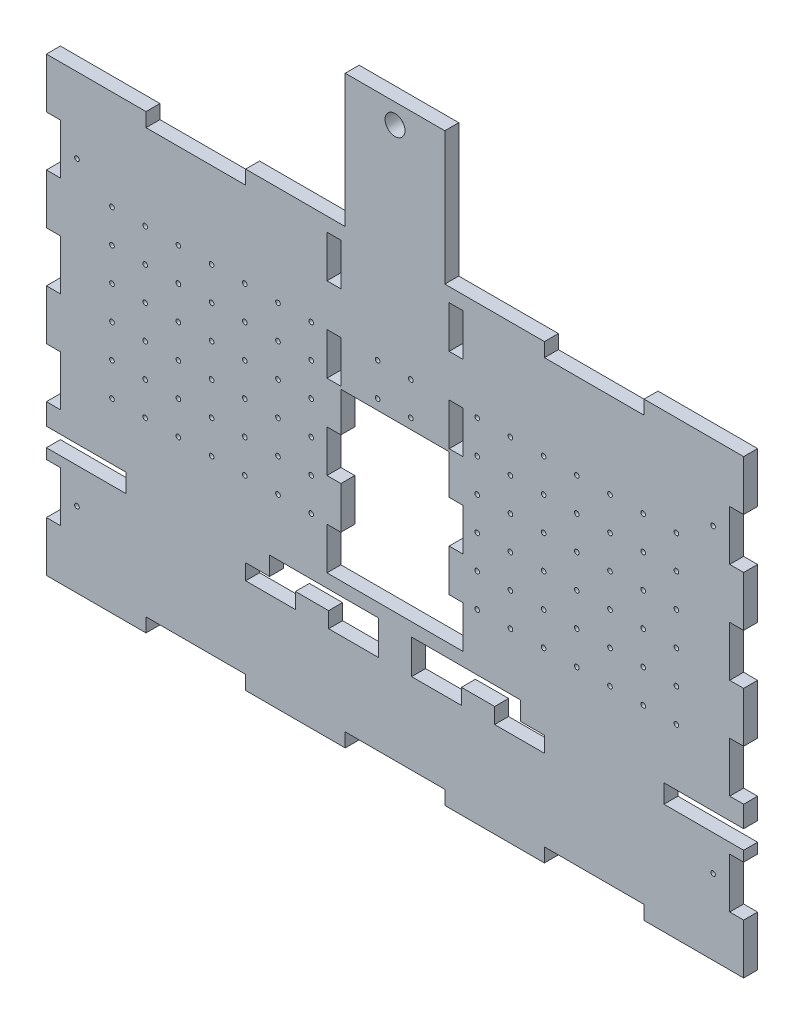
from build123d import *

# Parameters (mm, degrees)
SKETCH1_W           = 266.7
SKETCH1_H           = 172.72
BOSS_EXTRUDE1_DEPTH = 5.334
SKETCH2_W           = 38.1
SKETCH2_H           = 5.334
CUT_EXTRUDE1_DEPTH  = 165.701204222
SKETCH5_W           = 41.656
SKETCH5_H           = 7.112
CUT_EXTRUDE3_DEPTH  = 165.701204222
SKETCH9_W           = 5.334
SKETCH9_H           = 19.191111111
CUT_EXTRUDE7_DEPTH  = 165.701204222
SKETCH10_W          = 38.1
SKETCH10_H          = 5.334
BOSS_EXTRUDE2_DEPTH = 50.8
SKETCH11_W          = 6.604
SKETCH11_H          = 40.64
CUT_EXTRUDE8_DEPTH  = 197.710659379
SKETCH12_R          = 3.81
CUT_EXTRUDE9_DEPTH  = 197.710659379
SKETCH14_R          = 0.889
CUT_EXTRUDE11_DEPTH = 197.710659379
SKETCH15_W          = 6.604
SKETCH15_H          = 10.16
CUT_EXTRUDE12_DEPTH = 197.710659379
SKETCH16_W          = 41.402
SKETCH16_H          = 63.5
CUT_EXTRUDE13_DEPTH = 197.710659379
SKETCH17_W          = 5.334
SKETCH17_H          = 16.124650759
SKETCH17_H_2        = 16.124650758
CUT_EXTRUDE14_DEPTH = 197.710659379
SKETCH18_W          = 38.1
SKETCH18_H          = 56.134
BOSS_EXTRUDE3_DEPTH = 5.334
SKETCH19_W          = 34.756768033
SKETCH19_H          = 54.94363668
CUT_EXTRUDE15_DEPTH = 197.710659379
SKETCH20_R          = 3.81
CUT_EXTRUDE16_DEPTH = 197.710659379
SKETCH21_R          = 0.889
CUT_EXTRUDE17_DEPTH = 197.710659379
SKETCH22_W          = 19.05
SKETCH22_H          = 5.993691658
CUT_EXTRUDE18_DEPTH = 197.710659379


with BuildPart() as part:
    # Sketch1 → Boss-Extrude1 (new body)
    with BuildSketch(Plane.XY):
        with Locations((5.474099752, 2.104142138)):
            Rectangle(SKETCH1_W, SKETCH1_H)
    extrude(amount=BOSS_EXTRUDE1_DEPTH)

    # Sketch2 → Cut-Extrude1 (cut, through all)
    with BuildSketch(Plane.XY.offset(5.334)):
        with Locations((-70.725900248, -81.588857862)):
            Rectangle(SKETCH2_W, SKETCH2_H)
        with Locations((5.474099752, -81.588857862)):
            Rectangle(SKETCH2_W, SKETCH2_H)
        with Locations((81.674099752, -81.588857862)):
            Rectangle(SKETCH2_W, SKETCH2_H)
        with Locations((81.674099752, 85.797142138)):
            Rectangle(SKETCH2_W, SKETCH2_H)
        with Locations((5.474099752, 85.797142138)):
            Rectangle(SKETCH2_W, SKETCH2_H)
        with Locations((-70.725900248, 85.797142138)):
            Rectangle(SKETCH2_W, SKETCH2_H)
    extrude(amount=-CUT_EXTRUDE1_DEPTH, mode=Mode.SUBTRACT)

    # Sketch5 → Cut-Extrude3 (cut, through all)
    with BuildSketch(Plane.XY.offset(5.334)):
        with Locations((32.652099752, -38.378413173)):
            Rectangle(SKETCH5_W, SKETCH5_H)
        with Locations((-21.703900248, -38.378413173)):
            Rectangle(SKETCH5_W, SKETCH5_H)
        with Locations((-118.223900248, -38.378413173)):
            Rectangle(SKETCH5_W, SKETCH5_H)
        with Locations((129.172099752, -38.378413173)):
            Rectangle(SKETCH5_W, SKETCH5_H)
    extrude(amount=-CUT_EXTRUDE3_DEPTH, mode=Mode.SUBTRACT)

    # Sketch9 → Cut-Extrude7 (cut, through all)
    with BuildSketch(Plane.XY.offset(5.334)):
        with Locations((-125.208900248, -55.469191196)):
            Rectangle(SKETCH9_W, SKETCH9_H)
        with Locations((-125.208900248, -17.086968973)):
            Rectangle(SKETCH9_W, SKETCH9_H)
        with Locations((-125.208900248, 21.295253249)):
            Rectangle(SKETCH9_W, SKETCH9_H)
        with Locations((-125.208900248, 59.677475472)):
            Rectangle(SKETCH9_W, SKETCH9_H)
        with Locations((136.157099752, 59.677475472)):
            Rectangle(SKETCH9_W, SKETCH9_H)
        with Locations((136.157099752, 21.295253249)):
            Rectangle(SKETCH9_W, SKETCH9_H)
        with Locations((136.157099752, -17.086968973)):
            Rectangle(SKETCH9_W, SKETCH9_H)
        with Locations((136.157099752, -55.469191196)):
            Rectangle(SKETCH9_W, SKETCH9_H)
    extrude(amount=-CUT_EXTRUDE7_DEPTH, mode=Mode.SUBTRACT)

    # Sketch10 → Boss-Extrude2 (add)
    with BuildSketch(Plane(origin=(0, 88.464142138, 0), x_dir=(1, 0, 0), z_dir=(0, 1, 0))):
        with Locations((43.574099752, -2.667)):
            Rectangle(SKETCH10_W, SKETCH10_H)
    extrude(amount=BOSS_EXTRUDE2_DEPTH)

    # Sketch11 → Cut-Extrude8 (cut, through all)
    with BuildSketch(Plane(origin=(0, 0, 0), x_dir=(-1, 0, 0), z_dir=(0, 0, -1))):
        with Locations((-27.826099752, 108.784142138)):
            Rectangle(SKETCH11_W, SKETCH11_H)
    extrude(amount=-CUT_EXTRUDE8_DEPTH, mode=Mode.SUBTRACT)

    # Sketch12 → Cut-Extrude9 (cut, through all)
    with BuildSketch(Plane.XY.offset(5.334)):
        with Locations((43.574099752, 130.476471297)):
            Circle(SKETCH12_R)
    extrude(amount=-CUT_EXTRUDE9_DEPTH, mode=Mode.SUBTRACT)

    # Sketch14 → Cut-Extrude11 (cut, through all)
    with BuildSketch(Plane.XY.offset(5.334)):
        with Locations((-102.797588144, 50.364142138)):
            Circle(SKETCH14_R)
        with Locations((-90.097588144, 50.364142138)):
            Circle(SKETCH14_R)
        with Locations((-77.397588144, 50.364142138)):
            Circle(SKETCH14_R)
        with Locations((-64.697588144, 50.364142138)):
            Circle(SKETCH14_R)
        with Locations((-51.997588144, 50.364142138)):
            Circle(SKETCH14_R)
        with Locations((-39.297588144, 50.364142138)):
            Circle(SKETCH14_R)
        with Locations((-26.597588144, 50.364142138)):
            Circle(SKETCH14_R)
        with Locations((-1.197588144, 50.364142138)):
            Circle(SKETCH14_R)
        with Locations((11.502411856, 50.364142138)):
            Circle(SKETCH14_R)
        with Locations((36.902411856, 50.364142138)):
            Circle(SKETCH14_R)
        with Locations((49.602411856, 50.364142138)):
            Circle(SKETCH14_R)
        with Locations((62.302411856, 50.364142138)):
            Circle(SKETCH14_R)
        with Locations((75.002411856, 50.364142138)):
            Circle(SKETCH14_R)
        with Locations((87.702411856, 50.364142138)):
            Circle(SKETCH14_R)
        with Locations((100.402411856, 50.364142138)):
            Circle(SKETCH14_R)
        with Locations((113.102411856, 50.364142138)):
            Circle(SKETCH14_R)
        with Locations((-102.797588144, 37.664142138)):
            Circle(SKETCH14_R)
        with Locations((-90.097588144, 37.664142138)):
            Circle(SKETCH14_R)
        with Locations((-77.397588144, 37.664142138)):
            Circle(SKETCH14_R)
        with Locations((-64.697588144, 37.664142138)):
            Circle(SKETCH14_R)
        with Locations((-51.997588144, 37.664142138)):
            Circle(SKETCH14_R)
        with Locations((-39.297588144, 37.664142138)):
            Circle(SKETCH14_R)
        with Locations((-26.597588144, 37.664142138)):
            Circle(SKETCH14_R)
        with Locations((-1.197588144, 37.664142138)):
            Circle(SKETCH14_R)
        with Locations((11.502411856, 37.664142138)):
            Circle(SKETCH14_R)
        with Locations((36.902411856, 37.664142138)):
            Circle(SKETCH14_R)
        with Locations((49.602411856, 37.664142138)):
            Circle(SKETCH14_R)
        with Locations((62.302411856, 37.664142138)):
            Circle(SKETCH14_R)
        with Locations((75.002411856, 37.664142138)):
            Circle(SKETCH14_R)
        with Locations((87.702411856, 37.664142138)):
            Circle(SKETCH14_R)
        with Locations((100.402411856, 37.664142138)):
            Circle(SKETCH14_R)
        with Locations((113.102411856, 37.664142138)):
            Circle(SKETCH14_R)
        with Locations((-102.797588144, 24.964142138)):
            Circle(SKETCH14_R)
        with Locations((-90.097588144, 24.964142138)):
            Circle(SKETCH14_R)
        with Locations((-77.397588144, 24.964142138)):
            Circle(SKETCH14_R)
        with Locations((-64.697588144, 24.964142138)):
            Circle(SKETCH14_R)
        with Locations((-51.997588144, 24.964142138)):
            Circle(SKETCH14_R)
        with Locations((-39.297588144, 24.964142138)):
            Circle(SKETCH14_R)
        with Locations((-26.597588144, 24.964142138)):
            Circle(SKETCH14_R)
        with Locations((-1.197588144, 24.964142138)):
            Circle(SKETCH14_R)
        with Locations((11.502411856, 24.964142138)):
            Circle(SKETCH14_R)
        with Locations((36.902411856, 24.964142138)):
            Circle(SKETCH14_R)
        with Locations((49.602411856, 24.964142138)):
            Circle(SKETCH14_R)
        with Locations((62.302411856, 24.964142138)):
            Circle(SKETCH14_R)
        with Locations((75.002411856, 24.964142138)):
            Circle(SKETCH14_R)
        with Locations((87.702411856, 24.964142138)):
            Circle(SKETCH14_R)
        with Locations((100.402411856, 24.964142138)):
            Circle(SKETCH14_R)
        with Locations((113.102411856, 24.964142138)):
            Circle(SKETCH14_R)
        with Locations((-102.797588144, 12.264142138)):
            Circle(SKETCH14_R)
        with Locations((-90.097588144, 12.264142138)):
            Circle(SKETCH14_R)
        with Locations((-77.397588144, 12.264142138)):
            Circle(SKETCH14_R)
        with Locations((-64.697588144, 12.264142138)):
            Circle(SKETCH14_R)
        with Locations((-51.997588144, 12.264142138)):
            Circle(SKETCH14_R)
        with Locations((-39.297588144, 12.264142138)):
            Circle(SKETCH14_R)
        with Locations((-26.597588144, 12.264142138)):
            Circle(SKETCH14_R)
        with Locations((36.902411856, 12.264142138)):
            Circle(SKETCH14_R)
        with Locations((49.602411856, 12.264142138)):
            Circle(SKETCH14_R)
        with Locations((62.302411856, 12.264142138)):
            Circle(SKETCH14_R)
        with Locations((75.002411856, 12.264142138)):
            Circle(SKETCH14_R)
        with Locations((87.702411856, 12.264142138)):
            Circle(SKETCH14_R)
        with Locations((100.402411856, 12.264142138)):
            Circle(SKETCH14_R)
        with Locations((113.102411856, 12.264142138)):
            Circle(SKETCH14_R)
        with Locations((-102.797588144, -0.435857862)):
            Circle(SKETCH14_R)
        with Locations((-90.097588144, -0.435857862)):
            Circle(SKETCH14_R)
        with Locations((-77.397588144, -0.435857862)):
            Circle(SKETCH14_R)
        with Locations((-64.697588144, -0.435857862)):
            Circle(SKETCH14_R)
        with Locations((-51.997588144, -0.435857862)):
            Circle(SKETCH14_R)
        with Locations((-39.297588144, -0.435857862)):
            Circle(SKETCH14_R)
        with Locations((-26.597588144, -0.435857862)):
            Circle(SKETCH14_R)
        with Locations((-13.897588144, -0.435857862)):
            Circle(SKETCH14_R)
        with Locations((-1.197588144, -0.435857862)):
            Circle(SKETCH14_R)
        with Locations((11.502411856, -0.435857862)):
            Circle(SKETCH14_R)
        with Locations((24.202411856, -0.435857862)):
            Circle(SKETCH14_R)
        with Locations((36.902411856, -0.435857862)):
            Circle(SKETCH14_R)
        with Locations((49.602411856, -0.435857862)):
            Circle(SKETCH14_R)
        with Locations((62.302411856, -0.435857862)):
            Circle(SKETCH14_R)
        with Locations((75.002411856, -0.435857862)):
            Circle(SKETCH14_R)
        with Locations((87.702411856, -0.435857862)):
            Circle(SKETCH14_R)
        with Locations((100.402411856, -0.435857862)):
            Circle(SKETCH14_R)
        with Locations((113.102411856, -0.435857862)):
            Circle(SKETCH14_R)
        with Locations((-102.797588144, -13.135857862)):
            Circle(SKETCH14_R)
        with Locations((-90.097588144, -13.135857862)):
            Circle(SKETCH14_R)
        with Locations((-77.397588144, -13.135857862)):
            Circle(SKETCH14_R)
        with Locations((-64.697588144, -13.135857862)):
            Circle(SKETCH14_R)
        with Locations((-51.997588144, -13.135857862)):
            Circle(SKETCH14_R)
        with Locations((-39.297588144, -13.135857862)):
            Circle(SKETCH14_R)
        with Locations((-26.597588144, -13.135857862)):
            Circle(SKETCH14_R)
        with Locations((-13.897588144, -13.135857862)):
            Circle(SKETCH14_R)
        with Locations((-1.197588144, -13.135857862)):
            Circle(SKETCH14_R)
        with Locations((11.502411856, -13.135857862)):
            Circle(SKETCH14_R)
        with Locations((24.202411856, -13.135857862)):
            Circle(SKETCH14_R)
        with Locations((36.902411856, -13.135857862)):
            Circle(SKETCH14_R)
        with Locations((49.602411856, -13.135857862)):
            Circle(SKETCH14_R)
        with Locations((62.302411856, -13.135857862)):
            Circle(SKETCH14_R)
        with Locations((75.002411856, -13.135857862)):
            Circle(SKETCH14_R)
        with Locations((87.702411856, -13.135857862)):
            Circle(SKETCH14_R)
        with Locations((100.402411856, -13.135857862)):
            Circle(SKETCH14_R)
        with Locations((113.102411856, -13.135857862)):
            Circle(SKETCH14_R)
    extrude(amount=-CUT_EXTRUDE11_DEPTH, mode=Mode.SUBTRACT)

    # Sketch15 → Cut-Extrude12 (cut, through all)
    with BuildSketch(Plane.XY.offset(5.334)):
        with Locations((27.826099752, 134.184142138)):
            Rectangle(SKETCH15_W, SKETCH15_H)
    extrude(amount=-CUT_EXTRUDE12_DEPTH, mode=Mode.SUBTRACT)

    # Sketch16 → Cut-Extrude13 (cut, through all)
    with BuildSketch(Plane.XY.offset(5.334)):
        with Locations((5.474099752, 2.007586827)):
            Rectangle(SKETCH16_W, SKETCH16_H)
    extrude(amount=-CUT_EXTRUDE13_DEPTH, mode=Mode.SUBTRACT)

    # Sketch17 → Cut-Extrude14 (cut, through all)
    with BuildSketch(Plane.XY.offset(5.334)):
        with Locations((-17.893900248, -21.680087794)):
            Rectangle(SKETCH17_W, SKETCH17_H)
        with Locations((-17.893900248, 10.569213724)):
            Rectangle(SKETCH17_W, SKETCH17_H)
        with Locations((-17.893900248, 42.818515241)):
            Rectangle(SKETCH17_W, SKETCH17_H_2)
        with Locations((-17.893900248, 75.067816759)):
            Rectangle(SKETCH17_W, SKETCH17_H)
        with Locations((28.842099752, 75.067816759)):
            Rectangle(SKETCH17_W, SKETCH17_H)
        with Locations((28.842099752, 42.818515241)):
            Rectangle(SKETCH17_W, SKETCH17_H_2)
        with Locations((28.842099752, 10.569213724)):
            Rectangle(SKETCH17_W, SKETCH17_H)
        with Locations((28.842099752, -21.680087794)):
            Rectangle(SKETCH17_W, SKETCH17_H)
    extrude(amount=-CUT_EXTRUDE14_DEPTH, mode=Mode.SUBTRACT)

    # Sketch18 → Boss-Extrude3 (add)
    with BuildSketch(Plane.XY.offset(5.334)):
        with Locations((5.474099752, 111.197142138)):
            Rectangle(SKETCH18_W, SKETCH18_H)
    extrude(amount=-BOSS_EXTRUDE3_DEPTH)

    # Sketch19 → Cut-Extrude15 (cut, through all)
    with BuildSketch(Plane.XY.offset(5.334)):
        with Locations((48.506483768, 115.935960478)):
            Rectangle(SKETCH19_W, SKETCH19_H)
    extrude(amount=-CUT_EXTRUDE15_DEPTH, mode=Mode.SUBTRACT)

    # Sketch20 → Cut-Extrude16 (cut, through all)
    with BuildSketch(Plane.XY.offset(5.334)):
        with Locations((5.474099752, 131.644142138)):
            Circle(SKETCH20_R)
    extrude(amount=-CUT_EXTRUDE16_DEPTH, mode=Mode.SUBTRACT)

    # Sketch21 → Cut-Extrude17 (cut, through all)
    with BuildSketch(Plane.XY.offset(5.334)):
        with Locations((127.140099752, 59.677475471)):
            Circle(SKETCH21_R)
        with Locations((-116.191900248, 59.677475471)):
            Circle(SKETCH21_R)
        with Locations((-116.191900248, -55.469191196)):
            Circle(SKETCH21_R)
        with Locations((127.140099752, -55.469191196)):
            Circle(SKETCH21_R)
    extrude(amount=-CUT_EXTRUDE17_DEPTH, mode=Mode.SUBTRACT)

    # Sketch22 → Cut-Extrude18 (cut, through all)
    with BuildSketch(Plane(origin=(0, 0, 0), x_dir=(-1, 0, 0), z_dir=(0, 0, -1))):
        with Locations((-21.349099752, -44.931259002)):
            Rectangle(SKETCH22_W, SKETCH22_H)
        with Locations((-53.099099752, -44.931259002)):
            Rectangle(SKETCH22_W, SKETCH22_H)
        with Locations((42.150900248, -44.931259002)):
            Rectangle(SKETCH22_W, SKETCH22_H)
        with Locations((10.400900248, -44.931259002)):
            Rectangle(SKETCH22_W, SKETCH22_H)
    extrude(amount=-CUT_EXTRUDE18_DEPTH, mode=Mode.SUBTRACT)


solid = part.part
